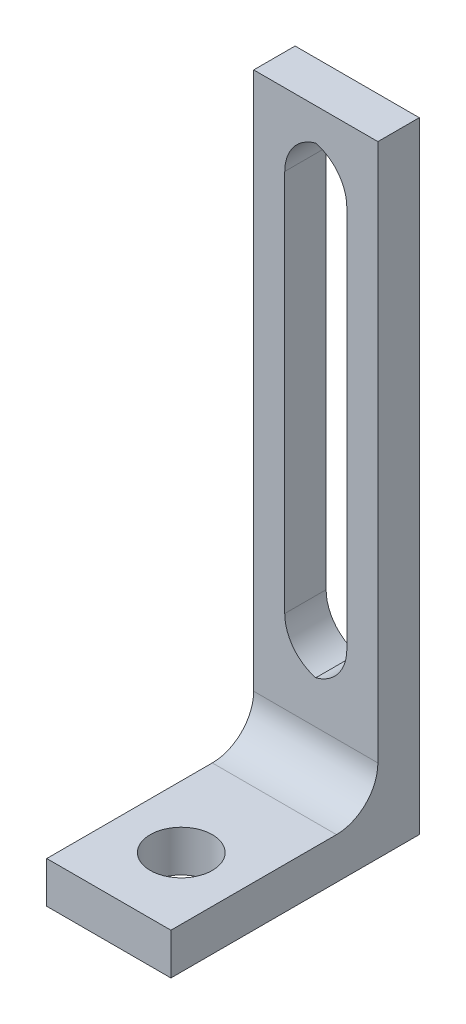
from build123d import *

# Parameters (mm, degrees)
SKETCH1_W           = 6
SKETCH1_H           = 30
SKETCH1_W_2         = 3
SKETCH1_H_2         = 22.5
BOSS_EXTRUDE1_DEPTH = 2
FILLET1_R           = 2
SKETCH2_W           = 6
SKETCH2_H           = 2
BOSS_EXTRUDE2_DEPTH = 10
FILLET2_R           = 2
SKETCH3_R           = 1.5
CUT_EXTRUDE1_DEPTH  = 10


with BuildPart() as part:
    # Sketch1 → Boss-Extrude1 (new body)
    with BuildSketch(Plane.XY):
        Rectangle(SKETCH1_W, SKETCH1_H)
        with Locations((0, 2.25)):
            Rectangle(SKETCH1_W_2, SKETCH1_H_2, mode=Mode.SUBTRACT)
    extrude(amount=BOSS_EXTRUDE1_DEPTH)

    # Fillet1
    # the kernel refuses this fillet: 2 mm, written as the material it adds along each edge
    with BuildSketch(Plane(origin=(1.5, 13.5, 0), x_dir=(0, -1, 0), z_dir=(0, 0, 1)), Plane(origin=(1.5, -9, 0), x_dir=(-1, 0, 0), z_dir=(0, 0, 1)), Plane(origin=(-1.5, -9, 0), x_dir=(0, 1, 0), z_dir=(0, 0, 1))) as fillet1_piece_1:
        with BuildLine():
            CenterArc((FILLET1_R, -FILLET1_R), FILLET1_R, 90, 90)
            Line((0, -FILLET1_R), (0, 0))
            Line((0, 0), (FILLET1_R, 0))
        make_face()
    extrude(amount=2)
    with BuildSketch(Plane(origin=(-1.5, 13.5, 0), x_dir=(0, -1, 0), z_dir=(0, 0, 1))) as fillet1_piece_2:
        with BuildLine():
            CenterArc((FILLET1_R, FILLET1_R), FILLET1_R, 180, 90)
            Line((0, FILLET1_R), (0, 0))
            Line((0, 0), (FILLET1_R, 0))
        make_face()
    extrude(amount=2)

    # Sketch2 → Boss-Extrude2 (add)
    with BuildSketch(Plane.XY.offset(2)):
        with Locations((0, -14)):
            Rectangle(SKETCH2_W, SKETCH2_H)
    extrude(amount=BOSS_EXTRUDE2_DEPTH)

    # Fillet2
    fillet2_edges = [part.edges().sort_by_distance(p)[0] for p in [
        (0, -13, 2),
    ]]
    fillet(fillet2_edges, radius=FILLET2_R)

    # Sketch3 → Cut-Extrude1 (cut)
    with BuildSketch(Plane(origin=(0, -13, 0), x_dir=(1, 0, 0), z_dir=(0, 1, 0))):
        with Locations(Location((0, -8.5, 0), (0, 0, 270))):
            Circle(SKETCH3_R)
    extrude(amount=-CUT_EXTRUDE1_DEPTH, mode=Mode.SUBTRACT)


solid = part.part
